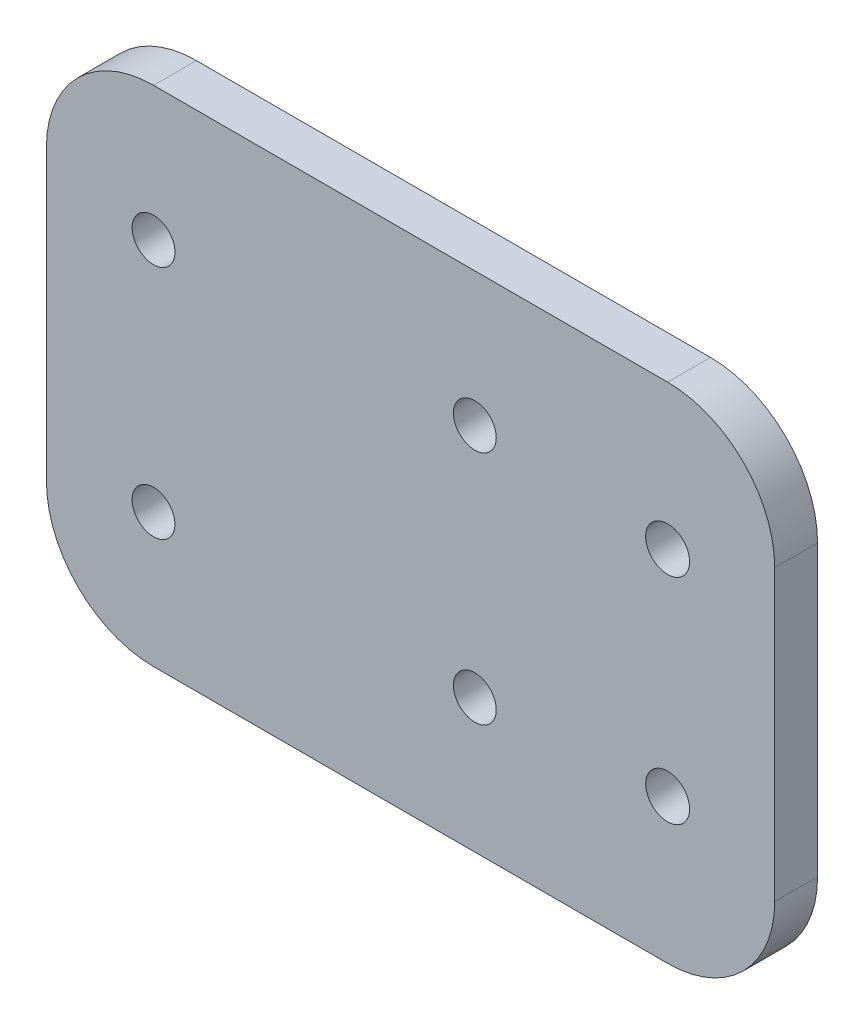
from build123d import *

# Parameters (mm, degrees)
SKETCH_1_W          = 68
SKETCH_1_H          = 47
EXTRUDE_1_DEPTH     = 4
FILLET_1_R          = 10
SKETCH_2_R          = 2
SKETCH_2_R_2        = 2.05
CUT_EXTRUDE_1_DEPTH = 4


with BuildPart() as part:
    # 草图1 → 凸台-拉伸1 (new body)
    with BuildSketch(Plane.XY):
        with Locations((34, 23.5)):
            Rectangle(SKETCH_1_W, SKETCH_1_H)
    extrude(amount=EXTRUDE_1_DEPTH)

    # 圆角1
    fillet_1_edges = [part.edges().sort_by_distance(p)[0] for p in [
        (0, 47, 2),
        (68, 0, 2),
        (0, 0, 2),
        (68, 47, 2),
    ]]
    fillet(fillet_1_edges, radius=FILLET_1_R)

    # 草图2 → 切除-拉伸1 (cut)
    with BuildSketch(Plane.XY.offset(4)):
        with Locations((10, 34.5)):
            Circle(SKETCH_2_R)
        with Locations((10, 12.5)):
            Circle(SKETCH_2_R)
        with Locations((40, 34.5)):
            Circle(SKETCH_2_R)
        with Locations((40, 12.5)):
            Circle(SKETCH_2_R)
        with Locations((58, 33.5)):
            Circle(SKETCH_2_R_2)
        with Locations((58, 13.5)):
            Circle(SKETCH_2_R_2)
    extrude(amount=-CUT_EXTRUDE_1_DEPTH, mode=Mode.SUBTRACT)


solid = part.part
